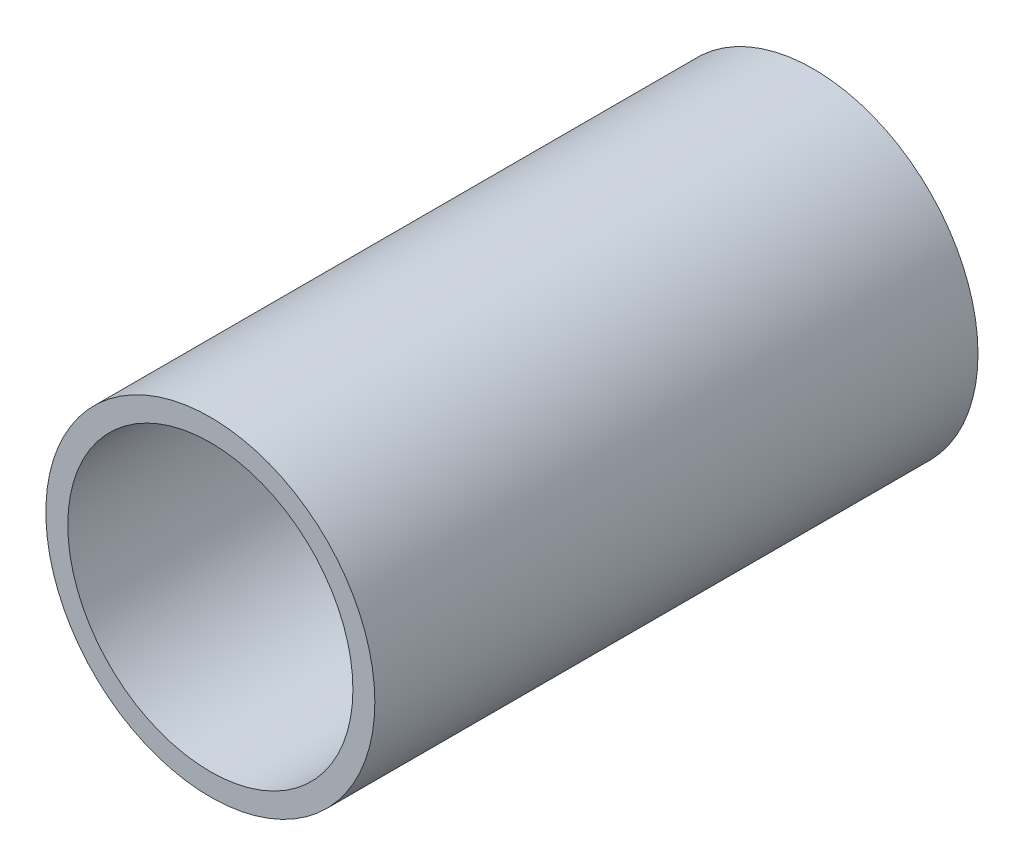
from build123d import *

# Parameters (mm, degrees)
SKETCH_1_R      = 60
SKETCH_1_R_2    = 52
EXTRUDE_1_DEPTH = 220


with BuildPart() as part:
    # Эскиз1 → Бобышка-Вытянуть1 (new body)
    with BuildSketch(Plane.XY):
        Circle(SKETCH_1_R)
        Circle(SKETCH_1_R_2, mode=Mode.SUBTRACT)
    extrude(amount=EXTRUDE_1_DEPTH)


solid = part.part
